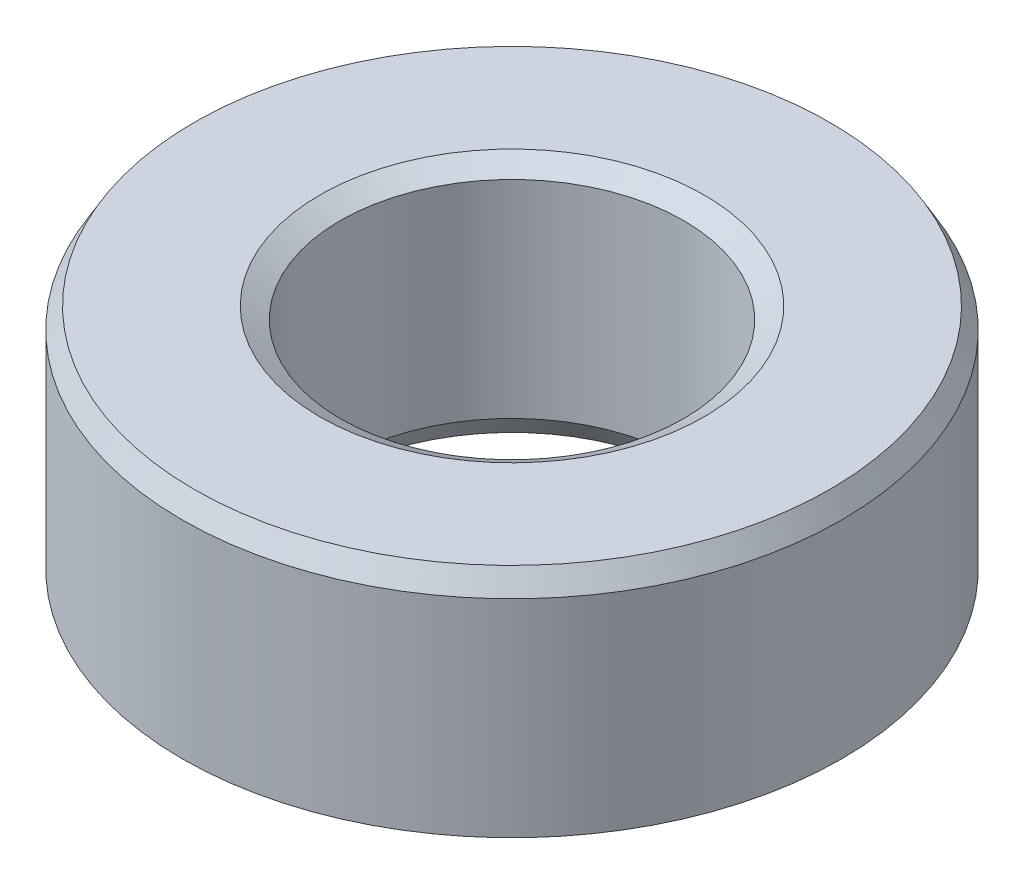
from build123d import *
from OCP.BRepFilletAPI import BRepFilletAPI_MakeChamfer

# Parameters (mm, degrees)
SKETCH1_R           = 15
BOSS_EXTRUDE1_DEPTH = 10.8877439
SKETCH2_R           = 7.808580656
CUT_EXTRUDE1_DEPTH  = 24.844139054
CHAMFER1_SIZE       = 0.934418498
CHAMFER1_SIZE2      = 0.539486771


with BuildPart() as part:
    # Sketch1 → Boss-Extrude1 (new body)
    with BuildSketch(Plane(origin=(0, 0, 0), x_dir=(1, 0, 0), z_dir=(0, 1, 0))):
        Circle(SKETCH1_R)
    extrude(amount=BOSS_EXTRUDE1_DEPTH)

    # Sketch2 → Cut-Extrude1 (cut, through all)
    with BuildSketch(Plane(origin=(0, 0, 0), x_dir=(1, 0, 0), z_dir=(0, 1, 0))):
        Circle(SKETCH2_R)
    extrude(amount=CUT_EXTRUDE1_DEPTH, mode=Mode.SUBTRACT)

    # Chamfer1: one chamfer whose edges measure the first distance from different faces: ONE call of the kernel's chamfer builder (chamfer() names one face for all edges)
    chamfer1_edges_1 = [part.edges().sort_by_distance(p)[0] for p in [
        (-7.808580656, 10.8877439, 0),
    ]]
    chamfer1_side_1 = [part.faces().sort_by_distance(p)[0] for p in [
        (-14.575735931, 10.8877439, 0),
    ]]
    chamfer1_edges_2 = [part.edges().sort_by_distance(p)[0] for p in [
        (-7.808580656, 0, 0),
    ]]
    chamfer1_side_2 = [part.faces().sort_by_distance(p)[0] for p in [
        (-7.808580656, 5.44387195, 0),
    ]]
    chamfer1_edges_3 = [part.edges().sort_by_distance(p)[0] for p in [
        (-15, 0, 0),
    ]]
    chamfer1_side_3 = [part.faces().sort_by_distance(p)[0] for p in [
        (-14.575735931, 0, 0),
    ]]
    chamfer1_edges_4 = [part.edges().sort_by_distance(p)[0] for p in [
        (-15, 10.8877439, 0),
    ]]
    chamfer1_side_4 = [part.faces().sort_by_distance(p)[0] for p in [
        (-15, 5.44387195, 0),
    ]]
    chamfer1 = BRepFilletAPI_MakeChamfer(part.part.solid().wrapped)
    for e in chamfer1_edges_1:
        chamfer1.Add(CHAMFER1_SIZE, CHAMFER1_SIZE2, e.wrapped, chamfer1_side_1[0].wrapped)  # the first distance lies on this face
    for e in chamfer1_edges_2:
        chamfer1.Add(CHAMFER1_SIZE, CHAMFER1_SIZE2, e.wrapped, chamfer1_side_2[0].wrapped)  # the first distance lies on this face
    for e in chamfer1_edges_3:
        chamfer1.Add(CHAMFER1_SIZE, CHAMFER1_SIZE2, e.wrapped, chamfer1_side_3[0].wrapped)  # the first distance lies on this face
    for e in chamfer1_edges_4:
        chamfer1.Add(CHAMFER1_SIZE, CHAMFER1_SIZE2, e.wrapped, chamfer1_side_4[0].wrapped)  # the first distance lies on this face
    add(Compound.cast(chamfer1.Shape()), mode=Mode.REPLACE)


solid = part.part
